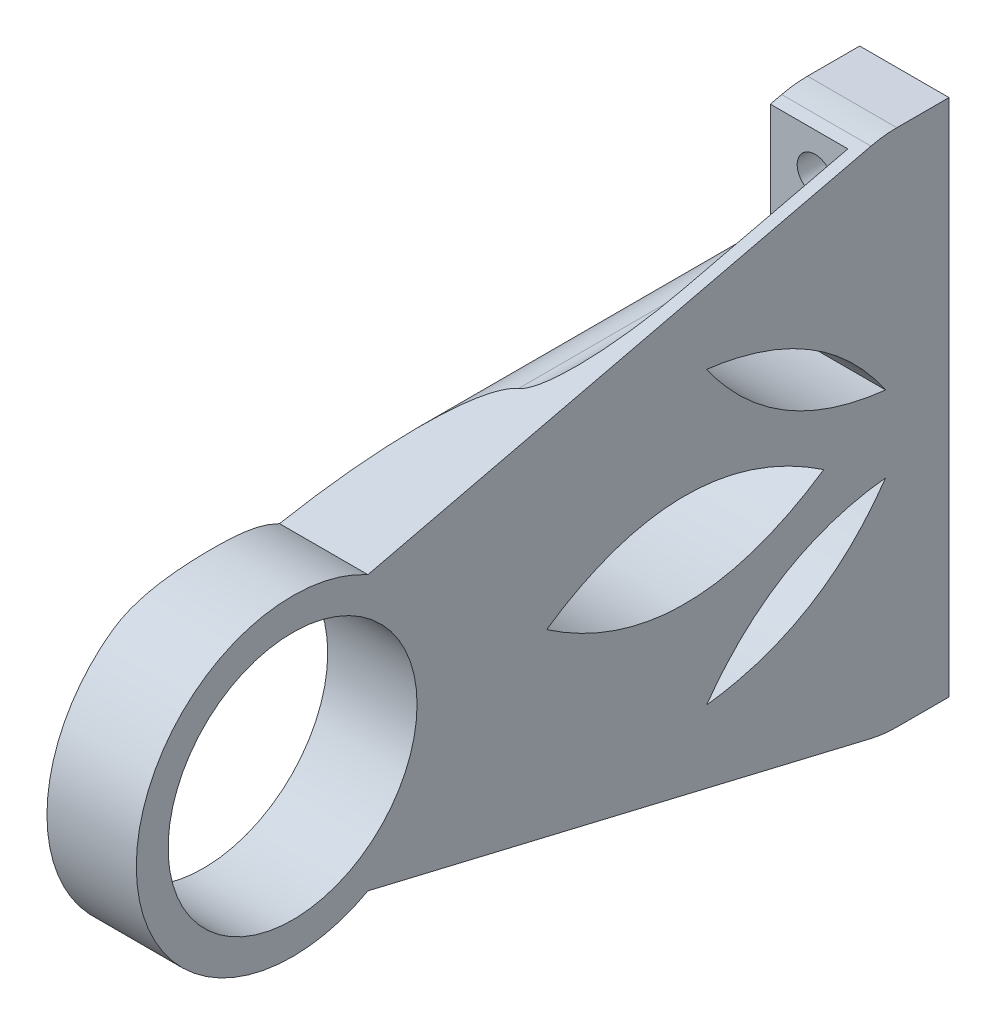
from build123d import *

# Parameters (mm, degrees)
SKETCH1_W           = 8.000974829
SKETCH1_H           = 46.5
BOSS_EXTRUDE1_DEPTH = 73
SKETCH2_R           = 11.15
CUT_EXTRUDE1_DEPTH  = 70
CUT_EXTRUDE3_DEPTH  = 62
SKETCH5_R           = 1.6
CUT_EXTRUDE4_DEPTH  = 62
FILLET2_START       = 8
FILLET2_DEPTH       = 60


with BuildPart() as part:
    # Sketch1 → Boss-Extrude1 (new body)
    with BuildSketch(Plane.XY):
        with Locations((34.458782271, 0)):
            Rectangle(SKETCH1_W, SKETCH1_H)
    extrude(amount=BOSS_EXTRUDE1_DEPTH)

    # Sketch2 → Cut-Extrude1 (cut)
    with BuildSketch(Plane(origin=(38.459269685, 0, 0), x_dir=(0, 0, -1), z_dir=(1, 0, 0))):
        with Locations((-58.8, 0)):
            Circle(SKETCH2_R)
        with BuildLine():
            Line((-73, -23.25), (-4.675968949, -23.25))
            ThreePointArc((-4.675968949, -23.25), (-5.84025075, -23.181991134), (-6.988696254, -22.978889578))
            Line((-6.988696254, -22.978889578), (-52.052198848, -12.266506414))
            ThreePointArc((-52.052198848, -12.266506414), (-63.616991815, -13.14521167), (-71.875840062, -5.002240165))
            Line((-71.875840062, -5.002240165), (-73, -8))
            Line((-73, -8), (-73, -23.25))
        make_face()
        with BuildLine():
            Line((-73, 23.25), (-73, 8))
            Line((-73, 8), (-71.875840062, 5.002240165))
            ThreePointArc((-71.875840062, 5.002240165), (-63.616991815, 13.14521167), (-52.052198848, 12.266506414))
            Line((-52.052198848, 12.266506414), (-6.988696254, 22.978889578))
            ThreePointArc((-6.988696254, 22.978889578), (-5.84025075, 23.181991134), (-4.675968949, 23.25))
            Line((-4.675968949, 23.25), (-73, 23.25))
        make_face()
        with BuildLine():
            Line((-73, 8), (-73, -8))
            Line((-73, -8), (-71.875840062, -5.002240165))
            ThreePointArc((-71.875840062, -5.002240165), (-72.8, 0), (-71.875840062, 5.002240165))
            Line((-71.875840062, 5.002240165), (-73, 8))
        make_face()
        with BuildLine():
            add(Edge.make_bspline(
                [(-5.680368735, -3.40627966), (-11.386784663, -11.746039667), (-21.714178832, -13.021085274)],
                knots=[0, 0, 0, 1, 1, 1], degree=2))
            add(Edge.make_bspline(
                [(-5.680368735, -3.40627966), (-15.724909711, -4.511710031), (-21.714178832, -13.021085274)],
                knots=[0, 0, 0, 1, 1, 1], degree=2))
        make_face()
        with BuildLine():
            add(Edge.make_bspline(
                [(-36.048150351, 0), (-23.713645553, 8.388071288), (-11.218940507, 0)],
                knots=[0, 0, 0, 1, 1, 1], degree=2))
            add(Edge.make_bspline(
                [(-36.048150351, 0), (-23.713645553, -8.388071288), (-11.218940507, 0)],
                knots=[0, 0, 0, 1, 1, 1], degree=2))
        make_face()
        with BuildLine():
            add(Edge.make_bspline(
                [(-5.680368735, 3.40627966), (-15.724909711, 4.511710031), (-21.714178832, 13.021085274)],
                knots=[0, 0, 0, 1, 1, 1], degree=2))
            add(Edge.make_bspline(
                [(-5.680368735, 3.40627966), (-11.386784663, 11.746039667), (-21.714178832, 13.021085274)],
                knots=[0, 0, 0, 1, 1, 1], degree=2))
        make_face()
    extrude(amount=-CUT_EXTRUDE1_DEPTH, mode=Mode.SUBTRACT)

    # Sketch4 → Cut-Extrude3 (cut)
    with BuildSketch(Plane.XY.offset(70)):
        with BuildLine():
            ThreePointArc((37.397007822, -19.25), (36.536421482, -17.172360788), (34.458782271, -16.311774449))
            Line((34.458782271, -16.311774449), (30.458294856, -16.311774449))
            Line((30.458294856, -16.311774449), (30.458294856, -22.188225551))
            Line((30.458294856, -22.188225551), (30.458294856, -24.738187672))
            Line((30.458294856, -24.738187672), (37.397007822, -23.25))
            Line((37.397007822, -23.25), (37.397007822, -19.25))
        make_face()
        with BuildLine():
            Line((30.458294856, 24.500594278), (30.458294856, 22.188225551))
            Line((30.458294856, 22.188225551), (30.458294856, 16.311774449))
            Line((30.458294856, 16.311774449), (34.458782271, 16.311774449))
            ThreePointArc((34.458782271, 16.311774449), (36.536421482, 17.172360788), (37.397007822, 19.25))
            Line((37.397007822, 19.25), (37.397007822, 23.25))
            Line((37.397007822, 23.25), (30.458294856, 24.500594278))
        make_face()
    extrude(amount=-CUT_EXTRUDE3_DEPTH, mode=Mode.SUBTRACT)

    # Sketch5 → Cut-Extrude4 (cut)
    with BuildSketch(Plane.XY.offset(8)):
        with Locations((34.458782271, 19.25)):
            Circle(SKETCH5_R)
        with Locations((34.458782271, -19.25)):
            Circle(SKETCH5_R)
    extrude(amount=-CUT_EXTRUDE4_DEPTH, mode=Mode.SUBTRACT)

    # Fillet2: read off the stored shape, not the designer's step
    # Fillet2 outline → Fillet2 (cut)
    with BuildSketch(Plane.XY.offset(FILLET2_START)):
        with BuildLine():
            ThreePointArc((34.828738175, -16.33515832), (31.706776269, -14.680417252), (30.458294856, -11.374950824))
            Line((30.458294856, -11.374950824), (30.458294856, -16.311774449))
            Line((30.458294856, -16.311774449), (34.458782271, -16.311774449))
            ThreePointArc((34.458782271, -16.311774449), (34.644129362, -16.317626244), (34.828738175, -16.33515832))
        make_face()
        with BuildLine():
            Line((30.458294856, 16.311774449), (30.458294856, 11.374950826))
            ThreePointArc((30.458294856, 11.374950826), (31.70677627, 14.680417253), (34.828738175, 16.33515832))
            ThreePointArc((34.828738175, 16.33515832), (34.644129362, 16.317626244), (34.458782271, 16.311774449))
            Line((34.458782271, 16.311774449), (30.458294856, 16.311774449))
        make_face()
    extrude(amount=FILLET2_DEPTH, mode=Mode.SUBTRACT)


solid = part.part
